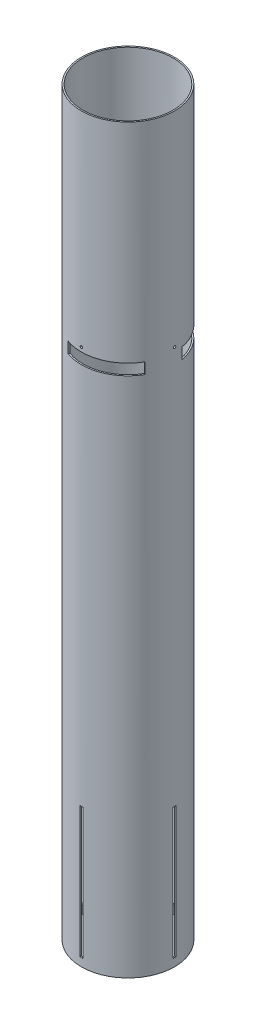
from build123d import *

# Parameters (mm, degrees)
SKETCH1_R           = 51.1048
SKETCH1_R_2         = 49.53
BOSS_EXTRUDE1_DEPTH = 812.8
CUT_EXTRUDE1_DEPTH  = 817.00688794
CIRPATTERN1_COUNT   = 4
CUT_EXTRUDE2_DEPTH  = 817.00688794
CIRPATTERN2_COUNT   = 4
SKETCH3_R           = 3.175
CUT_EXTRUDE3_DEPTH  = 817.006888053
CUT_EXTRUDE4_START  = -12.065
CUT_EXTRUDE4_DEPTH  = 12.065
CIRPATTERN3_COUNT   = 3


with BuildPart() as part:
    # Sketch1 → Boss-Extrude1 (new body)
    with BuildSketch(Plane(origin=(0, 0, 0), x_dir=(1, 0, 0), z_dir=(0, 1, 0))):
        Circle(SKETCH1_R)
        Circle(SKETCH1_R_2, mode=Mode.SUBTRACT)
    extrude(amount=BOSS_EXTRUDE1_DEPTH)

    # Sketch2 → Cut-Extrude1 (cut, through all)
    with BuildSketch(Plane(origin=(0, 0, 0), x_dir=(0, 0, -1), z_dir=(1, 0, 0))):
        Polygon((0, 8.89), (1.5875, 8.89), (1.5875, 152.4), (-1.5875, 152.4), (-1.5875, 8.89), align=None)
    cut_extrude1 = extrude(amount=-CUT_EXTRUDE1_DEPTH, mode=Mode.SUBTRACT)

    # CirPattern1: Cut-Extrude1 ×4 about axis
    cirpattern1_axis = Axis((0, 0, 0), (0, 1, 0))
    for i in range(1, CIRPATTERN1_COUNT):
        add(cut_extrude1.rotate(cirpattern1_axis, i * 360 / CIRPATTERN1_COUNT), mode=Mode.SUBTRACT)

    # Sketch2<3> → Cut-Extrude2 (cut, through all)
    with BuildSketch(Plane(origin=(0, 0, 0), x_dir=(0, 0, -1), z_dir=(1, 0, 0))):
        with BuildLine():
            ThreePointArc((0, 589.99755), (-0.956397277, 587.688602723), (1.35255, 588.645))
            ThreePointArc((1.35255, 588.645), (0.956397277, 589.601397277), (0, 589.99755))
        make_face()
    cut_extrude2 = extrude(amount=-CUT_EXTRUDE2_DEPTH, mode=Mode.SUBTRACT)

    # CirPattern2: Cut-Extrude2 ×4 about axis
    cirpattern2_axis = Axis((0, 812.8, 0), (0, -1, 0))
    for i in range(1, CIRPATTERN2_COUNT):
        add(cut_extrude2.rotate(cirpattern2_axis, i * 360 / CIRPATTERN2_COUNT), mode=Mode.SUBTRACT)

    # Sketch3 → Cut-Extrude3 (cut, through all)
    with BuildSketch(Plane(origin=(0, 0, 0), x_dir=(0.7071067811865477, 0, -0.7071067811865475), z_dir=(0.7071067811865475, 0, 0.7071067811865477))):
        with Locations((0, 127)):
            Circle(SKETCH3_R)
    extrude(amount=-CUT_EXTRUDE3_DEPTH, mode=Mode.SUBTRACT)

    # Sketch7 → Cut-Extrude4 (cut)
    with BuildSketch(Plane(origin=(0, 583.8825, 0), x_dir=(1, 0, 0), z_dir=(0, 1, 0)).offset(CUT_EXTRUDE4_START)):
        with BuildLine():
            Line((-44.258055055, -25.5524), (-42.894238249, -24.765))
            ThreePointArc((-42.894238249, -24.765), (-48.777528007, 8.60079424), (-31.837270308, 37.942181268))
            Line((-31.837270308, 37.942181268), (-32.849532236, 39.148548057))
            ThreePointArc((-32.849532236, 39.148548057), (-46.026790738, 22.208897258), (-51.086898433, 1.35255))
            ThreePointArc((-51.086898433, 1.35255), (-51.1048, 0), (-51.086898433, -1.35255))
            ThreePointArc((-51.086898433, -1.35255), (-49.184074902, -13.87902587), (-44.258055055, -25.5524))
        make_face()
    cut_extrude4 = extrude(amount=CUT_EXTRUDE4_DEPTH, mode=Mode.SUBTRACT)

    # CirPattern3: Cut-Extrude4 ×3 about axis
    cirpattern3_axis = Axis((0, 812.8, 0), (0, -1, 0))
    for i in range(1, CIRPATTERN3_COUNT):
        add(cut_extrude4.rotate(cirpattern3_axis, i * 360 / CIRPATTERN3_COUNT), mode=Mode.SUBTRACT)


solid = part.part
